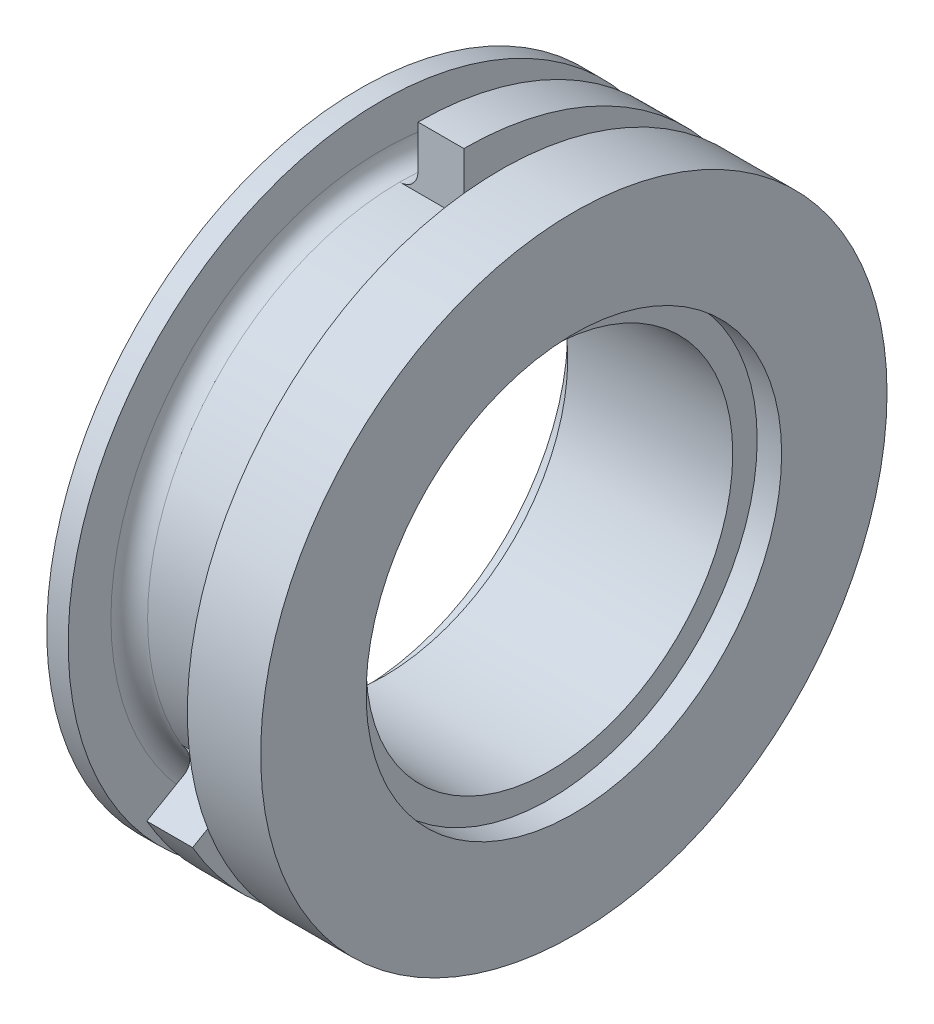
from build123d import *

# Parameters (mm, degrees)
SKETCH8_W          = 1.5
SKETCH8_H          = 2
CUT_REVOLVE1_ANGLE = 120
FILLET1_R          = 0.6
SKETCH3_R          = 6.8
CUT_EXTRUDE1_DEPTH = 0.8
CUT_EXTRUDE2_START = -0.8
SKETCH4_R          = 6.8
CUT_EXTRUDE2_DEPTH = 0.8


with BuildPart() as part:
    # Sketch2 → Revolve1 (revolve)
    with BuildSketch(Plane(origin=(0, 0, 0), x_dir=(1, 0, 0), z_dir=(0, 1, 0))):
        Polygon((7, 10.25), (7, 6), (0, 6), (0, 10.25), (0.7, 10.25), (0.7, 8.25), (1.9, 8.25), (1.9, 10.25), (3.4, 10.25), (3.4, 8.25), (4.6, 8.25), (4.6, 10.25), align=None)
    revolve(axis=Axis((7, 0, 0), (-1, 0, 0)))

    # Sketch8 → Cut-Revolve1 (revolve, cut)
    with BuildSketch(Plane.XY):
        with Locations((2.65, 9.25)):
            Rectangle(SKETCH8_W, SKETCH8_H)
    revolve(axis=Axis((0, 0, 0), (1, 0, 0)), revolution_arc=CUT_REVOLVE1_ANGLE, mode=Mode.SUBTRACT)

    # Fillet1
    # the kernel refuses this fillet: 0.6 mm, written as the material it adds along each edge
    with BuildSketch(Plane(origin=(0.7, 0, 0), x_dir=(0, 0, -1), z_dir=(0, 1, 0))) as fillet1_piece_1:
        with BuildLine():
            CenterArc((8.25 + FILLET1_R, -FILLET1_R), FILLET1_R, 90, 90)
            Line((8.25, -FILLET1_R), (8.25, 0))
            Line((8.25, 0), (8.25 + FILLET1_R, 0))
        make_face()
    revolve(axis=Axis((0.7, 0, 0), (-1, 0, 0)))
    with BuildSketch(Plane(origin=(4.6, 0, 0), x_dir=(0, 0, -1), z_dir=(0, 1, 0))) as fillet1_piece_2:
        with BuildLine():
            CenterArc((8.25 + FILLET1_R, FILLET1_R), FILLET1_R, 180, 90)
            Line((8.25, FILLET1_R), (8.25, 0))
            Line((8.25, 0), (8.25 + FILLET1_R, 0))
        make_face()
    revolve(axis=Axis((4.6, 0, 0), (-1, 0, 0)))
    with BuildSketch(Plane(origin=(1.9, 0, 0), x_dir=(0, 0, -1), z_dir=(0, 1, 0))) as fillet1_piece_3:
        with BuildLine():
            CenterArc((8.25 + FILLET1_R, FILLET1_R), FILLET1_R, 180, 90)
            Line((8.25 + FILLET1_R, 0), (8.25, 0))
            Line((8.25, 0), (8.25, FILLET1_R))
        make_face()
    revolve(axis=Axis((1.9, 0, 0), (-1, 0, 0)), revolution_arc=150)
    with BuildSketch(Plane(origin=(3.4, 0, 0), x_dir=(0, 0, -1), z_dir=(0, 1, 0))) as fillet1_piece_4:
        with BuildLine():
            CenterArc((8.25 + FILLET1_R, -FILLET1_R), FILLET1_R, 90, 90)
            Line((8.25 + FILLET1_R, 0), (8.25, 0))
            Line((8.25, 0), (8.25, -FILLET1_R))
        make_face()
    revolve(axis=Axis((3.4, 0, 0), (-1, 0, 0)), revolution_arc=150)
    with BuildSketch(Plane(origin=(3.4, 0, 0), x_dir=(0, 1, 0), z_dir=(0, 0, 1))) as fillet1_piece_5:
        with BuildLine():
            CenterArc((8.25 + FILLET1_R, -FILLET1_R), FILLET1_R, 90, 90)
            Line((8.25 + FILLET1_R, 0), (8.25, 0))
            Line((8.25, 0), (8.25, -FILLET1_R))
        make_face()
    revolve(axis=Axis((3.4, 0, 0), (-1, 0, 0)), revolution_arc=90)
    with BuildSketch(Plane(origin=(1.9, 0, 0), x_dir=(0, 1, 0), z_dir=(0, 0, 1))) as fillet1_piece_6:
        with BuildLine():
            CenterArc((8.25 + FILLET1_R, FILLET1_R), FILLET1_R, 180, 90)
            Line((8.25 + FILLET1_R, 0), (8.25, 0))
            Line((8.25, 0), (8.25, FILLET1_R))
        make_face()
    revolve(axis=Axis((1.9, 0, 0), (-1, 0, 0)), revolution_arc=90)

    # Sketch3 → Cut-Extrude1 (cut)
    with BuildSketch(Plane(origin=(7, 0, 0), x_dir=(0, 0, -1), z_dir=(1, 0, 0))):
        Circle(SKETCH3_R)
    extrude(amount=-CUT_EXTRUDE1_DEPTH, mode=Mode.SUBTRACT)

    # Sketch4 → Cut-Extrude2 (cut)
    with BuildSketch(Plane.ZY.offset(CUT_EXTRUDE2_START)):
        with Locations(Location((0, 0, 0), (0, 0, 180))):
            Circle(SKETCH4_R)
    extrude(amount=CUT_EXTRUDE2_DEPTH, mode=Mode.SUBTRACT)


solid = part.part
